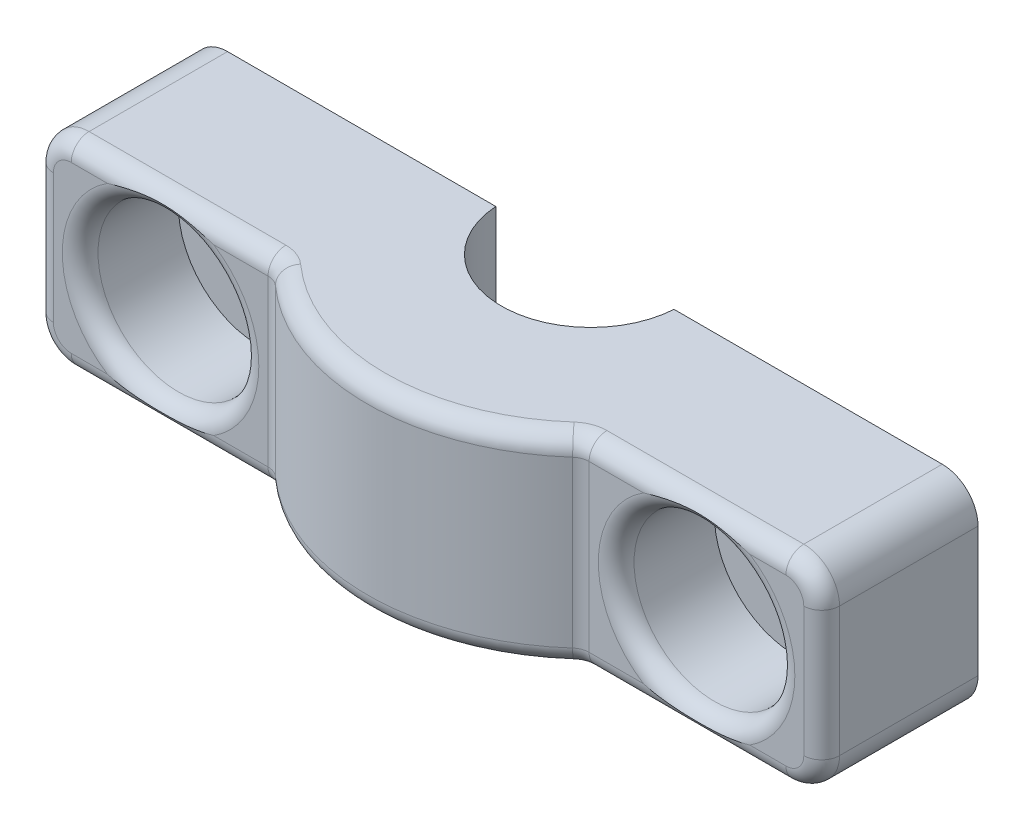
from build123d import *

# Parameters (mm, degrees)
BOSS_EXTRUDE2_DEPTH = 11.25
SKETCH3_R           = 1.75
CUT_EXTRUDE1_DEPTH  = 15
SKETCH4_R           = 4.5
CUT_EXTRUDE2_DEPTH  = 5.5
FILLET1_R           = 2
FILLET2_R           = 1
SKETCH5_W           = 43.999736238
SKETCH5_H           = 0.25
CUT_EXTRUDE3_DEPTH  = 20


with BuildPart() as part:
    # Sketch2 → Boss-Extrude2 (new body)
    with BuildSketch(Plane(origin=(0, 0, 0), x_dir=(1, 0, 0), z_dir=(0, 1, 0))):
        with BuildLine():
            Line((4.999419692, -0.076175713), (21.999868119, -0.076175713))
            Line((21.999868119, -0.076175713), (21.999868119, -9.076175713))
            Line((21.999868119, -9.076175713), (8.594942375, -9.076175713))
            ThreePointArc((8.594942375, -9.076175713), (0, -12.5), (-8.594942375, -9.076175713))
            Line((-8.594942375, -9.076175713), (-21.999868119, -9.076175713))
            Line((-21.999868119, -9.076175713), (-21.999868119, -0.076175713))
            Line((-21.999868119, -0.076175713), (-4.999419692, -0.076175713))
            ThreePointArc((-4.999419692, -0.076175713), (0, -5), (4.999419692, -0.076175713))
        make_face()
    extrude(amount=BOSS_EXTRUDE2_DEPTH)

    # Sketch3 → Cut-Extrude1 (cut)
    with BuildSketch(Plane.XY.offset(9.076175713)):
        with Locations((15, 5.625)):
            Circle(SKETCH3_R)
        with Locations((-15, 5.625)):
            Circle(SKETCH3_R)
    extrude(amount=-CUT_EXTRUDE1_DEPTH, mode=Mode.SUBTRACT)

    # Sketch4 → Cut-Extrude2 (cut)
    with BuildSketch(Plane.XY.offset(9.076175713)):
        with Locations((15, 5.625)):
            Circle(SKETCH4_R)
        with Locations((-15, 5.625)):
            Circle(SKETCH4_R)
    extrude(amount=-CUT_EXTRUDE2_DEPTH, mode=Mode.SUBTRACT)

    # Fillet1
    fillet1_edges = [part.edges().sort_by_distance(p)[0] for p in [
        (-21.999868119, 11.25, 4.576175713),
        (21.999868119, 11.25, 4.576175713),
        (21.999868119, 0, 4.576175713),
        (-21.999868119, 0, 4.576175713),
    ]]
    fillet(fillet1_edges, radius=FILLET1_R)

    # Fillet2
    # the kernel refuses this fillet: 1 mm, written as the material it adds along each edge
    with BuildSketch(Plane(origin=(8.594942375, 0, 9.076175713), x_dir=(-0.7363214838652496, 0, 0.6766318588408892), z_dir=(0, 1, 0))) as fillet2_piece_1:
        with BuildLine():
            CenterArc((0.389815045, 0.9998876), FILLET2_R, 227.418998023, 41.721940681)
            Line((-0.286816814, 0.263566116), (0, 0))
            ThreePointArc((0, 0), (0.187411079, 0.001404995), (0.374822159, 0))
        make_face()
    extrude(amount=11.25)
    with BuildSketch(Plane(origin=(-8.594942375, 0, 9.076175713), x_dir=(-1, 0, 0), z_dir=(0, 1, 0))) as fillet2_piece_2:
        with BuildLine():
            CenterArc((0.389526613, 1), FILLET2_R, 228.278059319, 41.721940681)
            ThreePointArc((-0.275989608, 0.253616614), (-0.137044139, 0.127842835), (0, 0))
            Line((0, 0), (0.389526613, 0))
        make_face()
    extrude(amount=11.25)
    # the kernel refuses this fillet: 1 mm, written as the material it takes off along each edge
    with BuildSketch(Plane(origin=(15, 5.625, 9.076175713), x_dir=(1, 0, 0), z_dir=(0, -1, 0))) as fillet2_2_piece_1:
        with BuildLine():
            CenterArc((4.5 + FILLET2_R, -FILLET2_R), FILLET2_R, 90, 90)
            Line((4.5, -FILLET2_R), (4.5, 0))
            Line((4.5, 0), (4.5 + FILLET2_R, 0))
        make_face()
    revolve(axis=Axis((15, 5.625, 9.076175713), (0, 0, 1)), mode=Mode.SUBTRACT)
    with BuildSketch(Plane(origin=(-15, 5.625, 9.076175713), x_dir=(1, 0, 0), z_dir=(0, -1, 0))) as fillet2_2_piece_2:
        with BuildLine():
            CenterArc((4.5 + FILLET2_R, -FILLET2_R), FILLET2_R, 90, 90)
            Line((4.5, -FILLET2_R), (4.5, 0))
            Line((4.5, 0), (4.5 + FILLET2_R, 0))
        make_face()
    revolve(axis=Axis((-15, 5.625, 9.076175713), (0, 0, 1)), mode=Mode.SUBTRACT)
    # the kernel refuses this fillet: 1 mm, written as the material it takes off along each edge
    with BuildSketch(Plane(origin=(0, 11.25, 0), x_dir=(0.6655162213477791, 0, 0.7463833861514965), z_dir=(0.7463833861514965, 0, -0.6655162213477791))) as fillet2_3_piece_1:
        with BuildLine():
            CenterArc((12.5 - FILLET2_R, FILLET2_R), FILLET2_R, 270, 90)
            Line((12.5, FILLET2_R), (12.5, 0))
            Line((12.5, 0), (12.5 - FILLET2_R, 0))
        make_face()
    revolve(axis=Axis((0, 11.25, 0), (0, -1, 0)), revolution_arc=83.443881362, mode=Mode.SUBTRACT)
    with BuildSketch(Plane(origin=(19.999868119, 11.25, 9.076175713), x_dir=(0, 0, -1), z_dir=(-1, 0, 0)), Plane(origin=(-8.984468988, 0, 9.076175713), x_dir=(0, 1, 0), z_dir=(-1, 0, 0))) as fillet2_3_piece_2:
        with BuildLine():
            CenterArc((FILLET2_R, FILLET2_R), FILLET2_R, 180, 90)
            Line((0, FILLET2_R), (0, 0))
            Line((0, 0), (FILLET2_R, 0))
        make_face()
    extrude(amount=11.015399131, mode=Mode.SUBTRACT)
    with BuildSketch(Plane(origin=(21.999868119, 2, 9.076175713), x_dir=(-1, 0, 0), z_dir=(0, 1, 0))) as fillet2_3_piece_3:
        with BuildLine():
            CenterArc((FILLET2_R, -FILLET2_R), FILLET2_R, 90, 90)
            Line((0, -FILLET2_R), (0, 0))
            Line((0, 0), (FILLET2_R, 0))
        make_face()
    extrude(amount=7.25, mode=Mode.SUBTRACT)
    with BuildSketch(Plane(origin=(19.999868119, 9.25, 9.076175713), x_dir=(0, 1, 0), z_dir=(-1, 0, 0))) as fillet2_3_piece_4:
        with BuildLine():
            CenterArc((2 - FILLET2_R, FILLET2_R), FILLET2_R, 270, 90)
            Line((2, FILLET2_R), (2, 0))
            Line((2, 0), (2 - FILLET2_R, 0))
        make_face()
    revolve(axis=Axis((19.999868119, 9.25, 9.076175713), (0, 0, -1)), revolution_arc=90, mode=Mode.SUBTRACT)
    with BuildSketch(Plane(origin=(19.999868119, 2, 9.076175713), x_dir=(0, -1, 0), z_dir=(-1, 0, 0))) as fillet2_3_piece_5:
        with BuildLine():
            CenterArc((2 - FILLET2_R, -FILLET2_R), FILLET2_R, 0, 90)
            Line((2 - FILLET2_R, 0), (2, 0))
            Line((2, 0), (2, -FILLET2_R))
        make_face()
    revolve(axis=Axis((19.999868119, 2, 9.076175713), (0, 0, 1)), revolution_arc=90, mode=Mode.SUBTRACT)
    with BuildSketch(Plane(origin=(-8.984468988, 11.25, 9.076175713), x_dir=(0, -1, 0), z_dir=(-1, 0, 0)), Plane(origin=(19.999868119, 0, 9.076175713), x_dir=(0, 0, -1), z_dir=(-1, 0, 0))) as fillet2_3_piece_6:
        with BuildLine():
            CenterArc((FILLET2_R, -FILLET2_R), FILLET2_R, 90, 90)
            Line((0, -FILLET2_R), (0, 0))
            Line((0, 0), (FILLET2_R, 0))
        make_face()
    extrude(amount=11.015399131, mode=Mode.SUBTRACT)
    with BuildSketch(Plane(origin=(-21.999868119, 2, 9.076175713), x_dir=(1, 0, 0), z_dir=(0, 1, 0))) as fillet2_3_piece_7:
        with BuildLine():
            CenterArc((FILLET2_R, FILLET2_R), FILLET2_R, 180, 90)
            Line((0, FILLET2_R), (0, 0))
            Line((0, 0), (FILLET2_R, 0))
        make_face()
    extrude(amount=7.25, mode=Mode.SUBTRACT)
    with BuildSketch(Plane(origin=(-19.999868119, 9.25, 9.076175713), x_dir=(0, 1, 0), z_dir=(1, 0, 0))) as fillet2_3_piece_8:
        with BuildLine():
            CenterArc((2 - FILLET2_R, -FILLET2_R), FILLET2_R, 360, 90)
            Line((2, -FILLET2_R), (2, 0))
            Line((2, 0), (2 - FILLET2_R, 0))
        make_face()
    revolve(axis=Axis((-19.999868119, 9.25, 9.076175713), (0, 0, 1)), revolution_arc=90, mode=Mode.SUBTRACT)
    with BuildSketch(Plane(origin=(-19.999868119, 2, 9.076175713), x_dir=(0, -1, 0), z_dir=(1, 0, 0))) as fillet2_3_piece_9:
        with BuildLine():
            CenterArc((2 - FILLET2_R, FILLET2_R), FILLET2_R, 270, 90)
            Line((2, FILLET2_R), (2, 0))
            Line((2, 0), (2 - FILLET2_R, 0))
        make_face()
    revolve(axis=Axis((-19.999868119, 2, 9.076175713), (0, 0, -1)), revolution_arc=90, mode=Mode.SUBTRACT)
    with BuildSketch(Plane(origin=(0, 0, 0), x_dir=(0.6655162213477791, 0, 0.7463833861514965), z_dir=(0.7463833861514965, 0, -0.6655162213477791))) as fillet2_3_piece_10:
        with BuildLine():
            CenterArc((12.5 - FILLET2_R, -FILLET2_R), FILLET2_R, 0, 90)
            Line((12.5, -FILLET2_R), (12.5, 0))
            Line((12.5, 0), (12.5 - FILLET2_R, 0))
        make_face()
    revolve(axis=Axis((0, 0, 0), (0, -1, 0)), revolution_arc=83.443881362, mode=Mode.SUBTRACT)
    with BuildSketch(Plane(origin=(8.984468988, 0, 10.076175713), x_dir=(-0.6655162213477794, 0, -0.7463833861514964), z_dir=(-0.7463833861514964, 0, 0.6655162213477794))) as fillet2_3_piece_11:
        with BuildLine():
            CenterArc((1 + FILLET2_R, -FILLET2_R), FILLET2_R, 90, 90)
            Line((1, -FILLET2_R), (1, 0))
            Line((1, 0), (1 + FILLET2_R, 0))
        make_face()
    revolve(axis=Axis((8.984468988, 0, 10.076175713), (0, -1, 0)), revolution_arc=41.721940681, mode=Mode.SUBTRACT)
    with BuildSketch(Plane(origin=(-8.984468988, 0, 10.076175713), x_dir=(0, 0, -1), z_dir=(-1, 0, 0))) as fillet2_3_piece_12:
        with BuildLine():
            CenterArc((1 + FILLET2_R, -FILLET2_R), FILLET2_R, 90, 90)
            Line((1, -FILLET2_R), (1, 0))
            Line((1, 0), (1 + FILLET2_R, 0))
        make_face()
    revolve(axis=Axis((-8.984468988, 0, 10.076175713), (0, -1, 0)), revolution_arc=41.721940681, mode=Mode.SUBTRACT)
    with BuildSketch(Plane(origin=(-8.984468988, 11.25, 10.076175713), x_dir=(0, 0, -1), z_dir=(-1, 0, 0))) as fillet2_3_piece_13:
        with BuildLine():
            CenterArc((1 + FILLET2_R, FILLET2_R), FILLET2_R, 180, 90)
            Line((1 + FILLET2_R, 0), (1, 0))
            Line((1, 0), (1, FILLET2_R))
        make_face()
    revolve(axis=Axis((-8.984468988, 11.25, 10.076175713), (0, -1, 0)), revolution_arc=41.721940681, mode=Mode.SUBTRACT)
    with BuildSketch(Plane(origin=(8.984468988, 11.25, 10.076175713), x_dir=(-0.6655162213477794, 0, -0.7463833861514964), z_dir=(-0.7463833861514964, 0, 0.6655162213477794))) as fillet2_3_piece_14:
        with BuildLine():
            CenterArc((1 + FILLET2_R, FILLET2_R), FILLET2_R, 180, 90)
            Line((1, FILLET2_R), (1, 0))
            Line((1, 0), (1 + FILLET2_R, 0))
        make_face()
    revolve(axis=Axis((8.984468988, 11.25, 10.076175713), (0, -1, 0)), revolution_arc=41.721940681, mode=Mode.SUBTRACT)

    # Sketch5 → Cut-Extrude3 (cut)
    with BuildSketch(Plane(origin=(0, 11.25, 0), x_dir=(1, 0, 0), z_dir=(0, 1, 0))):
        with Locations((0, -0.201175713)):
            Rectangle(SKETCH5_W, SKETCH5_H)
    extrude(amount=-CUT_EXTRUDE3_DEPTH, mode=Mode.SUBTRACT)


solid = part.part
